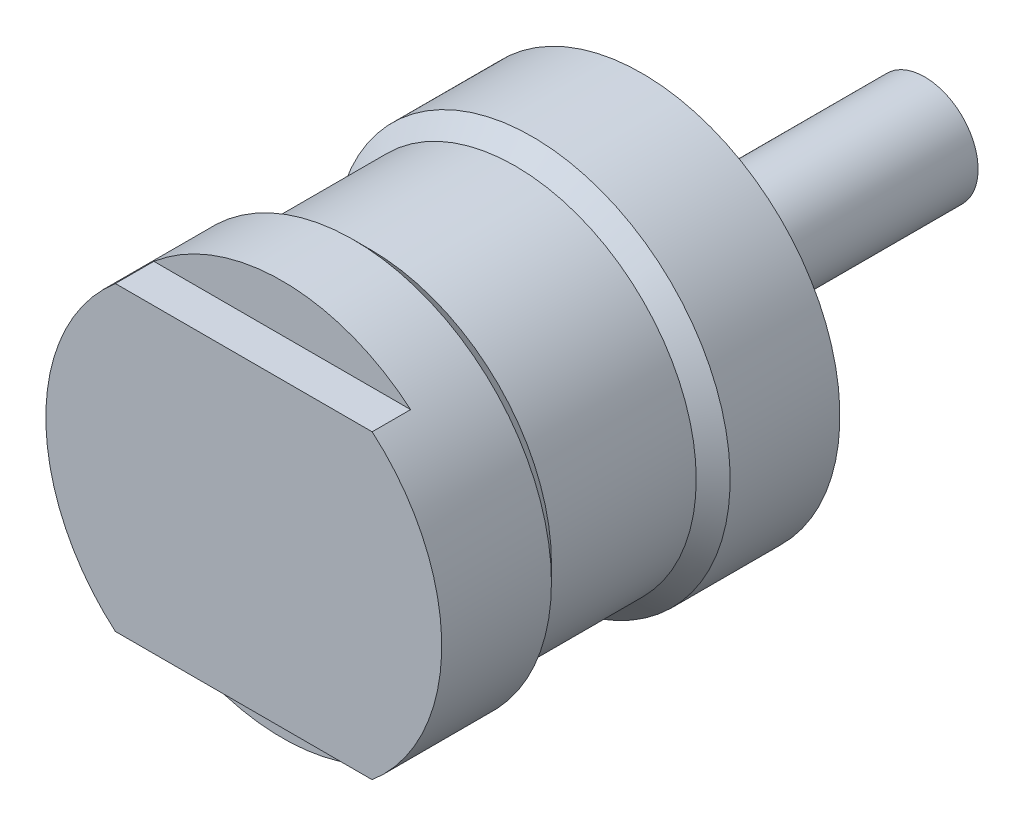
from build123d import *

# Parameters (mm, degrees)
SKETCH1_R           = 11.1125
BOSS_EXTRUDE1_DEPTH = 6.096
SKETCH2_R           = 10.16
BOSS_EXTRUDE2_DEPTH = 10.16
SKETCH3_R           = 11.1125
BOSS_EXTRUDE3_DEPTH = 6.096
CUT_EXTRUDE1_START  = -2.159
CUT_EXTRUDE1_DEPTH  = 2.159
CHAMFER1_SIZE       = 1.016
SKETCH5_R           = 5.08
BOSS_EXTRUDE4_DEPTH = 0.762
SKETCH6_R           = 3.937
BOSS_EXTRUDE5_DEPTH = 1.778
SKETCH7_R           = 2.9972
BOSS_EXTRUDE6_DEPTH = 13.335
SKETCH8_R           = 1.25
CUT_EXTRUDE2_DEPTH  = 7.747


with BuildPart() as part:
    # Sketch1 → Boss-Extrude1 (new body)
    with BuildSketch(Plane.XY):
        with Locations(Location((0, 0, 0), (0, 0, 180))):
            Circle(SKETCH1_R)
    extrude(amount=BOSS_EXTRUDE1_DEPTH)

    # Sketch2 → Boss-Extrude2 (add)
    with BuildSketch(Plane.XY.offset(6.096)):
        Circle(SKETCH2_R)
    extrude(amount=BOSS_EXTRUDE2_DEPTH)

    # Sketch3 → Boss-Extrude3 (add)
    with BuildSketch(Plane.XY.offset(16.256)):
        with Locations(Location((0, 0, 0), (0, 0, 180))):
            Circle(SKETCH3_R)
    extrude(amount=BOSS_EXTRUDE3_DEPTH)

    # Sketch4 → Cut-Extrude1 (cut)
    with BuildSketch(Plane.XY.offset(22.352).offset(CUT_EXTRUDE1_START)):
        with BuildLine():
            ThreePointArc((7.207392664, 8.4582), (0, 11.1125), (-7.207392664, 8.4582))
            Line((-7.207392664, 8.4582), (7.207392664, 8.4582))
        make_face()
        with BuildLine():
            Line((7.207392664, -8.4582), (-7.207392664, -8.4582))
            ThreePointArc((-7.207392664, -8.4582), (0, -11.1125), (7.207392664, -8.4582))
        make_face()
    extrude(amount=CUT_EXTRUDE1_DEPTH, mode=Mode.SUBTRACT)

    # Chamfer1
    # the kernel refuses this chamfer: 1.016 mm, written as the material it adds along each edge
    with BuildSketch(Plane(origin=(0, 0, 6.096), x_dir=(1, 0, 0), z_dir=(0, -1, 0))) as chamfer1_piece_1_section:
        Polygon((10.16, CHAMFER1_SIZE), (10.16 + CHAMFER1_SIZE, 0), (10.16, 0), align=None)
    chamfer1_piece_1 = revolve(axis=Axis((0, 0, 6.096), (0, 0, 1)), mode=Mode.PRIVATE)
    chamfer1_piece_1 = chamfer1_piece_1 & Plane(origin=(0, 0, 6.626545895), x_dir=(-1, 0, 0), z_dir=(0, 0, -1)) * Cylinder(11.1125, 45, mode=Mode.PRIVATE)
    add(chamfer1_piece_1)
    with BuildSketch(Plane(origin=(0, 0, 16.256), x_dir=(1, 0, 0), z_dir=(0, -1, 0))) as chamfer1_piece_2_section:
        Polygon((10.16 + CHAMFER1_SIZE, 0), (10.16, -CHAMFER1_SIZE), (10.16, 0), align=None)
    chamfer1_piece_2 = revolve(axis=Axis((0, 0, 16.256), (0, 0, 1)), mode=Mode.PRIVATE)
    chamfer1_piece_2 = chamfer1_piece_2 & Plane(origin=(0, 0, 15.725454105), x_dir=(-1, 0, 0), z_dir=(0, 0, -1)) * Cylinder(11.1125, 45, mode=Mode.PRIVATE)
    add(chamfer1_piece_2)

    # Sketch5 → Boss-Extrude4 (add)
    with BuildSketch(Plane(origin=(0, 0, 0), x_dir=(-1, 0, 0), z_dir=(0, 0, -1))):
        with Locations(Location((0, 0, 0), (0, 0, 180))):
            Circle(SKETCH5_R)
    extrude(amount=BOSS_EXTRUDE4_DEPTH)

    # Sketch6 → Boss-Extrude5 (add)
    with BuildSketch(Plane(origin=(0, 0, -0.762), x_dir=(-1, 0, 0), z_dir=(0, 0, -1))):
        Circle(SKETCH6_R)
    extrude(amount=BOSS_EXTRUDE5_DEPTH)

    # Sketch7 → Boss-Extrude6 (add)
    with BuildSketch(Plane(origin=(0, 0, -2.54), x_dir=(-1, 0, 0), z_dir=(0, 0, -1))):
        Circle(SKETCH7_R)
    extrude(amount=BOSS_EXTRUDE6_DEPTH)

    # Sketch8 → Cut-Extrude2 (cut)
    with BuildSketch(Plane(origin=(0, 0, 0), x_dir=(-1, 0, 0), z_dir=(0, 0, -1))):
        with Locations((7, 0)):
            Circle(SKETCH8_R)
        with Locations((-3.5, -6.062177826)):
            Circle(SKETCH8_R)
        with Locations((-3.5, 6.062177826)):
            Circle(SKETCH8_R)
    extrude(amount=-CUT_EXTRUDE2_DEPTH, mode=Mode.SUBTRACT)


solid = part.part
